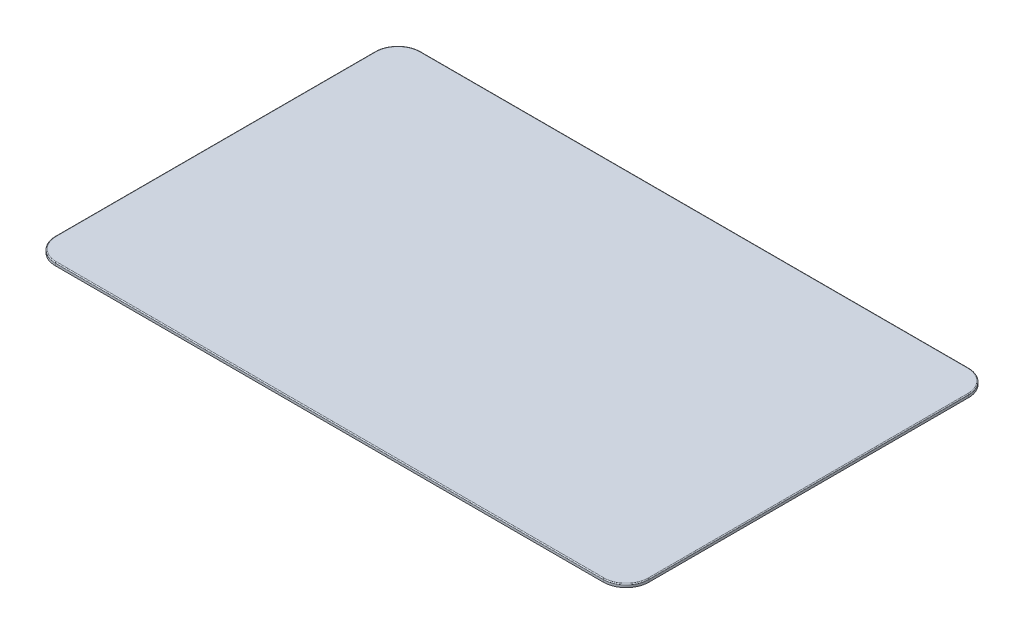
from build123d import *

# Parameters (mm, degrees)
EXTRUDE_1_DEPTH     = 7
FILLET_1_R          = 2
SKETCH_2_W          = 50
SKETCH_2_H          = 70
SKETCH_2_W_2        = 70
SKETCH_2_H_2        = 50
SKETCH_2_W_3        = 100
SKETCH_2_H_3        = 100
CUT_EXTRUDE_1_DEPTH = 5


with BuildPart() as part:
    # Эскиз1 → Бобышка-Вытянуть1 (new body)
    with BuildSketch(Plane(origin=(0, 0, 0), x_dir=(1, 0, 0), z_dir=(0, 1, 0))):
        with BuildLine():
            Line((-600, -400), (600, -400))
            ThreePointArc((600, -400), (635.355339059, -385.355339059), (650, -350))
            Line((650, -350), (650, 350))
            ThreePointArc((650, 350), (635.355339059, 385.355339059), (600, 400))
            Line((600, 400), (-600, 400))
            ThreePointArc((-600, 400), (-635.355339059, 385.355339059), (-650, 350))
            Line((-650, 350), (-650, -350))
            ThreePointArc((-650, -350), (-635.355339059, -385.355339059), (-600, -400))
        make_face()
    extrude(amount=EXTRUDE_1_DEPTH)

    # Скругление1
    fillet_1_edges = [part.edges().sort_by_distance(p)[0] for p in [
        (-635.355339059, 7, -385.355339059),
        (0, 7, -400),
        (635.355339059, 7, -385.355339059),
        (650, 7, 0),
        (635.355339059, 7, 385.355339059),
        (0, 7, 400),
        (-635.355339059, 7, 385.355339059),
        (-650, 7, 0),
    ]]
    fillet(fillet_1_edges, radius=FILLET_1_R)

    # Эскиз2 → Вырез-Вытянуть1 (cut)
    with BuildSketch(Plane.XZ):
        with Locations((-215, 248)):
            Rectangle(SKETCH_2_W, SKETCH_2_H)
        with Locations((-285, 248)):
            Rectangle(SKETCH_2_W, SKETCH_2_H)
        with Locations((285, 248)):
            Rectangle(SKETCH_2_W, SKETCH_2_H)
        with Locations((215, 248)):
            Rectangle(SKETCH_2_W, SKETCH_2_H)
        with Locations((215, -248)):
            Rectangle(SKETCH_2_W, SKETCH_2_H)
        with Locations((285, -248)):
            Rectangle(SKETCH_2_W, SKETCH_2_H)
        with Locations((-285, -248)):
            Rectangle(SKETCH_2_W, SKETCH_2_H)
        with Locations((-215, -248)):
            Rectangle(SKETCH_2_W, SKETCH_2_H)
        with Locations((-498, 35)):
            Rectangle(SKETCH_2_W_2, SKETCH_2_H_2)
        with Locations((-498, -35)):
            Rectangle(SKETCH_2_W_2, SKETCH_2_H_2)
        with Locations((498, -35)):
            Rectangle(SKETCH_2_W_2, SKETCH_2_H_2)
        with Locations((498, 35)):
            Rectangle(SKETCH_2_W_2, SKETCH_2_H_2)
        Rectangle(SKETCH_2_W, SKETCH_2_H)
        with Locations((60, 0)):
            Rectangle(SKETCH_2_W, SKETCH_2_H)
        with Locations((120, 0)):
            Rectangle(SKETCH_2_W, SKETCH_2_H)
        with Locations((-60, 0)):
            Rectangle(SKETCH_2_W, SKETCH_2_H)
        with Locations((-120, 0)):
            Rectangle(SKETCH_2_W, SKETCH_2_H)
        with Locations((-287.525490893, 0)):
            Rectangle(SKETCH_2_W_3, SKETCH_2_H_3)
    extrude(amount=-CUT_EXTRUDE_1_DEPTH, mode=Mode.SUBTRACT)


solid = part.part
